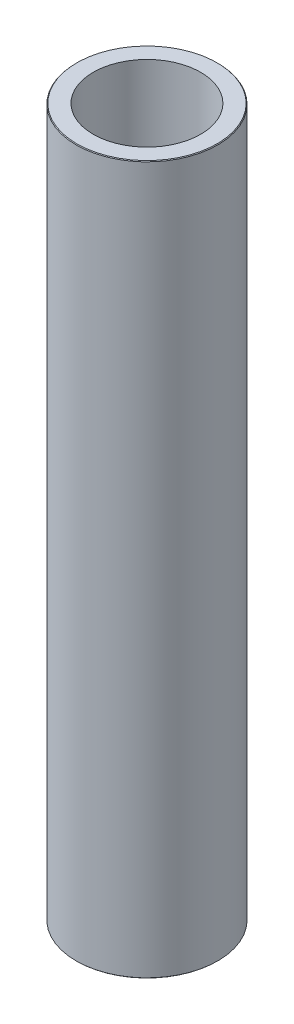
from build123d import *
from OCP.BRepFilletAPI import BRepFilletAPI_MakeChamfer

# Parameters (mm, degrees)
SKETCH1_R           = 60
BOSS_EXTRUDE1_DEPTH = 600
SKETCH2_R           = 45.546096507
CUT_EXTRUDE1_DEPTH  = 606.970296302
CHAMFER1_SIZE       = 0.580640029
CHAMFER1_SIZE2      = 0.539445161


with BuildPart() as part:
    # Sketch1 → Boss-Extrude1 (new body)
    with BuildSketch(Plane(origin=(0, 0, 0), x_dir=(1, 0, 0), z_dir=(0, 1, 0))):
        Circle(SKETCH1_R)
    extrude(amount=BOSS_EXTRUDE1_DEPTH)

    # Sketch2 → Cut-Extrude1 (cut, through all)
    with BuildSketch(Plane(origin=(0, 0, 0), x_dir=(1, 0, 0), z_dir=(0, 1, 0))):
        Circle(SKETCH2_R)
    extrude(amount=CUT_EXTRUDE1_DEPTH, mode=Mode.SUBTRACT)

    # Chamfer1: one chamfer whose edges measure the first distance from different faces: ONE call of the kernel's chamfer builder (chamfer() names one face for all edges)
    chamfer1_edges_1 = [part.edges().sort_by_distance(p)[0] for p in [
        (-60, 600, 0),
    ]]
    chamfer1_side_1 = [part.faces().sort_by_distance(p)[0] for p in [
        (-60, 300, 0),
    ]]
    chamfer1_edges_2 = [part.edges().sort_by_distance(p)[0] for p in [
        (-60, 0, 0),
    ]]
    chamfer1_side_2 = [part.faces().sort_by_distance(p)[0] for p in [
        (-58.302943725, 0, 0),
    ]]
    chamfer1 = BRepFilletAPI_MakeChamfer(part.part.solid().wrapped)
    for e in chamfer1_edges_1:
        chamfer1.Add(CHAMFER1_SIZE, CHAMFER1_SIZE2, e.wrapped, chamfer1_side_1[0].wrapped)  # the first distance lies on this face
    for e in chamfer1_edges_2:
        chamfer1.Add(CHAMFER1_SIZE, CHAMFER1_SIZE2, e.wrapped, chamfer1_side_2[0].wrapped)  # the first distance lies on this face
    add(Compound.cast(chamfer1.Shape()), mode=Mode.REPLACE)


solid = part.part
